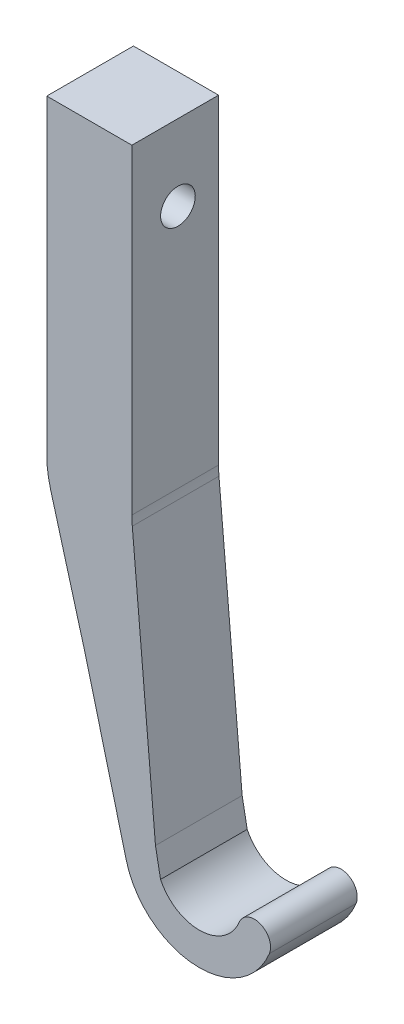
from build123d import *

# Parameters (mm, degrees)
SALIENTE_EXTRUIR2_DEPTH = 4
SALIENTE_EXTRUIR3_DEPTH = 4
REDONDEO1_R             = 10
REDONDEO2_R             = 10
CROQUIS4_R              = 1.6
CORTAR_EXTRUIR1_DEPTH   = 21.5


with BuildPart() as part:
    # Croquis2 → Saliente-Extruir2 (new, symmetric)
    with BuildSketch(Plane.XY):
        with BuildLine():
            ThreePointArc((3.679760923, -1.486719918), (-0.5866186, -3.925156708), (-3.953647708, -0.345899354))
            Line((-3.953647708, -0.345899354), (-6.229010011, 25.661610777))
            Line((-6.229010011, 25.661610777), (-6.229010011, 55.661610777))
            Line((-6.229010011, 55.661610777), (-14.085344509, 55.661610777))
            Line((-14.085344509, 55.661610777), (-14.085344509, 25.661610777))
            Line((-14.085344509, 25.661610777), (-6.96875, 0))
            ThreePointArc((-6.96875, 0), (-1.329700187, -6.840714435), (6.461312487, -2.610539698))
            ThreePointArc((6.461312487, -2.610539698), (5.632446595, -0.657854026), (3.679760923, -1.486719918))
        make_face()
    extrude(amount=SALIENTE_EXTRUIR2_DEPTH, both=True)

    # Croquis3 → Saliente-Extruir3 (add, symmetric)
    with BuildSketch(Plane.XY):
        Polygon((-10.527047254, 12.830805389), (-6.757235143, -1.70389254), (-3.584372578, -1.70389254), (-6.327047254, 12.830805389), align=None)
    extrude(amount=SALIENTE_EXTRUIR3_DEPTH, both=True)

    # Redondeo1
    redondeo1_edges = [part.edges().sort_by_distance(p)[0] for p in [
        (-14.085344509, 25.661610777, 0),
    ]]
    fillet(redondeo1_edges, radius=REDONDEO1_R)

    # Redondeo2
    # the kernel refuses this fillet: 10 mm, written as the material it adds along each edge
    with BuildSketch(Plane(origin=(-6.229010011, 25.661610777, -4), x_dir=(0, 1, 0), z_dir=(0, 0, 1))) as redondeo2_piece_1:
        with BuildLine():
            CenterArc((REDONDEO2_R * 0.0436609429085, -REDONDEO2_R), REDONDEO2_R, 90, 5)
            Line((-REDONDEO2_R * 0.0434947998391, -REDONDEO2_R * 0.00380530190825), (0, 0))
            Line((0, 0), (REDONDEO2_R * 0.0436609429085, 0))
        make_face()
    extrude(amount=8)

    # Croquis4 → Cortar-Extruir1 (cut)
    with BuildSketch(Plane.ZY.offset(14.085344509)):
        with Locations(Location((-0.25, 48.661610777, 0), (0, 0, 270))):
            Circle(CROQUIS4_R)
    extrude(amount=-CORTAR_EXTRUIR1_DEPTH, mode=Mode.SUBTRACT)


solid = part.part
